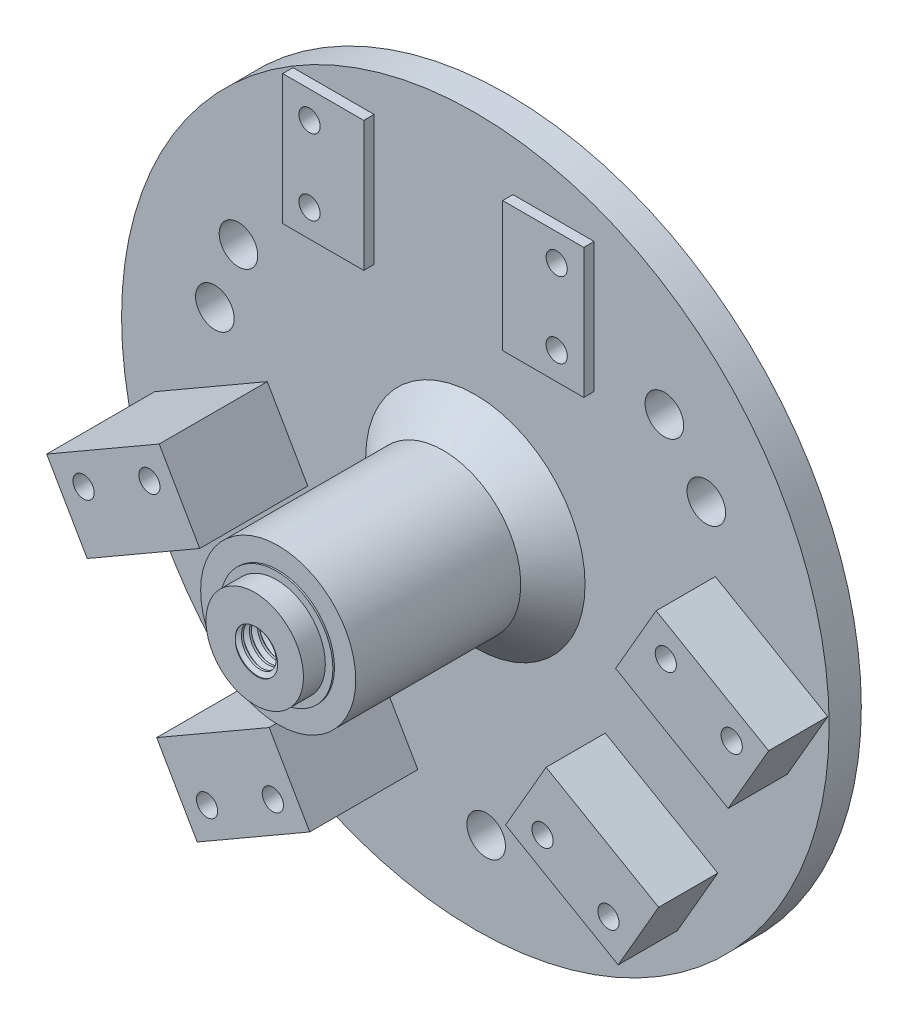
from build123d import *

# Parameters (mm, degrees)
SKETCH3_W               = 0.68
SKETCH3_H               = 3
SKETCH3_W_2             = 55
SKETCH3_H_2             = 5
CUT_EXTRUDE1_DEPTH      = 10
CUT_EXTRUDE1_DEPTH_BACK = 12
SKETCH2_R               = 3
BOSS_EXTRUDE1_DEPTH     = 16.8
SKETCH4_4_W             = 12.600000858
SKETCH4_4_H             = 20.200000763
SKETCH4_4_W_2           = 12.600000381
BOSS_EXTRUDE2_DEPTH     = 1.6
BOSS_EXTRUDE3_DEPTH     = 9.2
SKETCH5_R               = 3.1
CUT_EXTRUDE5_DEPTH      = 4
SKETCH5_4_R             = 3.1
CUT_EXTRUDE6_DEPTH      = 18
SKETCH5_5_R             = 3.1
CUT_EXTRUDE8_DEPTH      = 10.4
SKETCH7_R               = 1.65
CUT_EXTRUDE9_DEPTH      = 87.966717772
SCALE1_SCALE            = 2
SKETCH11_R              = 24.109521865
CUT_EXTRUDE11_DEPTH     = 174.602862566
SKETCH11_3_R            = 15.15
SKETCH11_3_R_2          = 7.930840121
BOSS_EXTRUDE4_DEPTH     = 6.8
SKETCH11_4_R            = 24.109521865
SKETCH11_4_R_2          = 17.5
CUT_EXTRUDE12_DEPTH     = 0.5
BOSS_EXTRUDE6_REACH     = 178.524
SKETCH18_R              = 7.930840121
SKETCH18_R_2            = 6
THREAD1_PITCH           = 2.5
BOSS_EXTRUDE5_REACH     = 166.561
SKETCH17_R              = 24.109521865


with BuildPart() as part:
    # Sketch3 → Revolve1 (revolve)
    with BuildSketch(Plane(origin=(0, 0, 0), x_dir=(1, 0, 0), z_dir=(0, 1, 0))):
        Polygon((-7.645420061, -35.9), (-4.645420061, -38.9), (-4.645420061, -35.9), align=None)
        with Locations((-4.305420061, -37.4)):
            Rectangle(SKETCH3_W, SKETCH3_H)
        Polygon((-12.054760933, -35.9), (-7.645420061, -35.9), (-4.645420061, -35.9), (-3.965420061, -35.9), (-3.965420061, -22.9), (-12.054760933, -22.9), align=None)
        Polygon((-12.054760933, -10), (-12.054760933, -22.9), (-3.965420061, -22.9), (0, -22.9), (0, -5), (-12.054760933, -5), align=None)
        Polygon((-17.054760933, -5), (-12.054760933, -10), (-12.054760933, -5), align=None)
        with Locations((-27.5, -2.5)):
            Rectangle(SKETCH3_W_2, SKETCH3_H_2)
    revolve(axis=Axis((0, 0, 5), (0, 0, 1)))

    # Sketch2 → Cut-Extrude1 (cut, two sides: drawn at the far end of the back side and taken through both)
    with BuildSketch(Plane.XY.offset(5).offset(-CUT_EXTRUDE1_DEPTH_BACK)):
        with Locations(Location((13.803478901, -39.013819102, 0), (0, 0, 180))):
            Circle(SKETCH2_R)
        with Locations(Location((35.899775547, 20.586894529, 0), (0, 0, 180))):
            Circle(SKETCH2_R)
        with Locations(Location((-40.493351311, 8.538302541, 0), (0, 0, 180))):
            Circle(SKETCH2_R)
        with Locations(Location((-36.826745231, 18.838441013, 0), (0, 0, 180))):
            Circle(SKETCH2_R)
        with Locations(Location((29.37902748, 29.059332082, 0), (0, 0, 180))):
            Circle(SKETCH2_R)
        with Locations(Location((1.676490042, -41.417283915, 0), (0, 0, 180))):
            Circle(SKETCH2_R)
    extrude(amount=CUT_EXTRUDE1_DEPTH + CUT_EXTRUDE1_DEPTH_BACK, mode=Mode.SUBTRACT)

    # Sketch4 → Boss-Extrude1 (add)
    with BuildSketch(Plane.XY.offset(5)):
        Polygon((-43.541591644, -18.383750916), (-49.841590881, -7.471831322), (-32.347877502, 2.628168583), (-26.047878265, -8.283751488), align=None)
        Polygon((-26.441591263, -48.001819611), (-32.741592407, -37.08990097), (-15.247878075, -26.989900589), (-8.947877884, -37.901821136), align=None)
    extrude(amount=BOSS_EXTRUDE1_DEPTH)

    # Sketch4<4> → Boss-Extrude2 (add)
    with BuildSketch(Plane.XY.offset(5)):
        with Locations((12.150000334, 36.800001145)):
            Rectangle(SKETCH4_4_W, SKETCH4_4_H)
        with Locations((-22.050000191, 36.800001145)):
            Rectangle(SKETCH4_4_W_2, SKETCH4_4_H)
    extrude(amount=BOSS_EXTRUDE2_DEPTH)

    # Sketch4<5> → Boss-Extrude3 (add)
    with BuildSketch(Plane.XY.offset(5)):
        Polygon((48.491592407, -9.810099602), (54.791591644, 1.10182023), (37.297878265, 11.201820374), (30.997879028, 0.289900124), align=None)
        Polygon((31.391592026, -39.42816925), (13.897878647, -29.328168869), (20.197877884, -18.416248322), (37.69159317, -28.516248703), align=None)
    extrude(amount=BOSS_EXTRUDE3_DEPTH)

    # Sketch5 → Cut-Extrude5 (cut)
    with BuildSketch(Plane(origin=(0, 0, 0), x_dir=(-1, 0, 0), z_dir=(0, 0, -1))):
        with BuildLine():
            ThreePointArc((-11.140577359, 30.950224204), (-12.048546338, 33.142255226), (-14.240577359, 34.050224204))
            Line((-14.240577359, 34.050224204), (-14.240577359, 30.950224204))
            Line((-14.240577359, 30.950224204), (-11.140577359, 30.950224204))
        make_face()
        with BuildLine():
            Line((-14.240577359, 30.950224204), (-14.240577359, 34.050224204))
            ThreePointArc((-14.240577359, 34.050224204), (-16.432608381, 28.758193182), (-11.140577359, 30.950224204))
            Line((-11.140577359, 30.950224204), (-14.240577359, 30.950224204))
        make_face()
        with BuildLine():
            ThreePointArc((27.283792738, 42.684548682), (24.183792738, 45.784548682), (21.083792738, 42.684548682))
            Line((21.083792738, 42.684548682), (24.183792738, 42.684548682))
            Line((24.183792738, 42.684548682), (24.183792738, 39.584548682))
            ThreePointArc((24.183792738, 39.584548682), (26.37582376, 40.49251766), (27.283792738, 42.684548682))
        make_face()
        with BuildLine():
            Line((24.183792738, 42.684548682), (21.083792738, 42.684548682))
            ThreePointArc((21.083792738, 42.684548682), (21.991761717, 40.49251766), (24.183792738, 39.584548682))
            Line((24.183792738, 39.584548682), (24.183792738, 42.684548682))
        make_face()
        with Locations((-14.240577359, 42.684548682)):
            Circle(SKETCH5_R)
        with Locations((24.183792738, 30.950224204)):
            Circle(SKETCH5_R)
    extrude(amount=-CUT_EXTRUDE5_DEPTH, mode=Mode.SUBTRACT)

    # Sketch5<4> → Cut-Extrude6 (cut)
    with BuildSketch(Plane(origin=(0, 0, 0), x_dir=(-1, 0, 0), z_dir=(0, 0, -1))):
        with Locations((33.875754671, -3.099811123)):
            Circle(SKETCH5_4_R)
        with Locations((44.099956238, -8.995818047)):
            Circle(SKETCH5_4_R)
        with Locations((24.908172665, -42.276081486)):
            Circle(SKETCH5_4_R)
        with Locations((14.683971099, -36.380074562)):
            Circle(SKETCH5_4_R)
    extrude(amount=-CUT_EXTRUDE6_DEPTH, mode=Mode.SUBTRACT)

    # Sketch5<5> → Cut-Extrude8 (cut)
    with BuildSketch(Plane(origin=(0, 0, 0), x_dir=(-1, 0, 0), z_dir=(0, 0, -1))):
        with Locations((-29.885597463, -33.693939972)):
            Circle(SKETCH5_5_R)
        with Locations((-19.645932494, -27.794047835)):
            Circle(SKETCH5_5_R)
        with Locations((-49.047480403, -0.437185967)):
            Circle(SKETCH5_5_R)
        with Locations((-38.807815434, 5.46270617)):
            Circle(SKETCH5_5_R)
    extrude(amount=-CUT_EXTRUDE8_DEPTH, mode=Mode.SUBTRACT)

    # Sketch7 → Cut-Extrude9 (cut, through all)
    with BuildSketch(Plane(origin=(0, 0, 0), x_dir=(-1, 0, 0), z_dir=(0, 0, -1))):
        with Locations((-38.807815434, 5.46270617)):
            Circle(SKETCH7_R)
        with Locations((-49.047480403, -0.437185967)):
            Circle(SKETCH7_R)
        with Locations((-14.240577359, 42.684548682)):
            Circle(SKETCH7_R)
        with Locations((-14.240577359, 30.950224204)):
            Circle(SKETCH7_R)
        with Locations((24.183792738, 30.950224204)):
            Circle(SKETCH7_R)
        with Locations((24.183792738, 42.684548682)):
            Circle(SKETCH7_R)
        with Locations((44.099956238, -8.995818047)):
            Circle(SKETCH7_R)
        with Locations((33.875754671, -3.099811123)):
            Circle(SKETCH7_R)
        with Locations((14.683971099, -36.380074562)):
            Circle(SKETCH7_R)
        with Locations((24.908172665, -42.276081486)):
            Circle(SKETCH7_R)
        with Locations((-19.645932494, -27.794047835)):
            Circle(SKETCH7_R)
        with Locations((-29.885597463, -33.693939972)):
            Circle(SKETCH7_R)
    extrude(amount=-CUT_EXTRUDE9_DEPTH, mode=Mode.SUBTRACT)


with BuildPart() as part_1:
    # Scale1: scaled about (-1.012493722, -2.511955492, 7.497325728)
    add(part.part.scale(SCALE1_SCALE).moved(Location((1.012493722, 2.511955492, -7.497325728))))

    # Sketch11 → Cut-Extrude11 (cut, through all)
    with BuildSketch(Plane.XY.offset(64.302674272)):
        with Locations(Location((1.012493722, 2.511955492, 0), (0, 0, 180))):
            Circle(SKETCH11_R)
    extrude(amount=CUT_EXTRUDE11_DEPTH, mode=Mode.SUBTRACT)

    # Sketch11<3> → Boss-Extrude4 (add)
    with BuildSketch(Plane.XY.offset(64.302674272)):
        with Locations((1.012493722, 2.511955492)):
            Circle(SKETCH11_3_R)
        with Locations(Location((1.012493722, 2.511955492, 0), (0, 0, 180))):
            Circle(SKETCH11_3_R_2, mode=Mode.SUBTRACT)
    extrude(amount=BOSS_EXTRUDE4_DEPTH)

    # Sketch11<4> → Cut-Extrude12 (cut)
    with BuildSketch(Plane.XY.offset(64.302674272)):
        with Locations(Location((1.012493722, 2.511955492, 0), (0, 0, 180))):
            Circle(SKETCH11_4_R)
        with Locations((1.012493722, 2.511955492)):
            Circle(SKETCH11_4_R_2, mode=Mode.SUBTRACT)
    extrude(amount=-CUT_EXTRUDE12_DEPTH, mode=Mode.SUBTRACT)

    # Sketch18 → Boss-Extrude6 (add, up to next)
    with BuildSketch(Plane.XY.offset(71.102674272), mode=Mode.PRIVATE) as boss_extrude6_sk1:
        with Locations((1.012493722, 2.511955492)):
            Circle(SKETCH18_R)
        with Locations((1.012493722, 2.511955492)):
            Circle(SKETCH18_R_2, mode=Mode.SUBTRACT)
    boss_extrude6_tool1 = extrude(boss_extrude6_sk1.sketch, amount=-BOSS_EXTRUDE6_REACH, mode=Mode.PRIVATE) - part_1.part
    add(boss_extrude6_tool1.solids().sort_by_distance((-6.694028, 2.511955, 71.102674))[0])

    # Thread1: arcs per turn and ends read off the stored shape
    # Thread1: the profile of Thread Profile1 profile screwed along a right-hand helix through 15.12 turns, 10 arcs to a turn; built about Z, then put on its axis
    thread1_z = Axis((0, 0, 0), (0, 0, 1))
    thread1_corners = [(5.9997, 0, -0.000173205), (7.353164688, 0, 0.781249997), (7.353164688, 0, 1.093749997), (5.9997, 0, 1.875173198)]
    with BuildLine(mode=Mode.PRIVATE) as thread1_profile:
        Line(thread1_corners[0], thread1_corners[1])
        Line(thread1_corners[1], thread1_corners[2])
        Line(thread1_corners[2], thread1_corners[3])
        Line(thread1_corners[3], thread1_corners[0])
    thread1_cap = Face(thread1_profile.wire())
    thread1_turn_angles = [0, 18, 36, 54, 72, 90, 108, 126, 144, 162, 180, 198, 216, 234, 252, 270, 288, 306, 324, 342, 360]
    thread1_turn_weights = [1, 0.9510565162951535, 1, 0.9510565162951535, 1, 0.9510565162951535, 1, 0.9510565162951535, 1, 0.9510565162951535, 1, 0.9510565162951535, 1, 0.9510565162951535, 1, 0.9510565162951535, 1, 0.9510565162951535, 1, 0.9510565162951535, 1]
    thread1_turn_rails = [Edge.make_bspline([Vector(p[0], p[1], 0).rotate(thread1_z, thread1_turn_angles[k]) / thread1_turn_weights[k] + Vector(0, 0, p[2] + THREAD1_PITCH * thread1_turn_angles[k] / 360) for k in range(21)], [0, 0, 0, 1, 1, 2, 2, 3, 3, 4, 4, 5, 5, 6, 6, 7, 7, 8, 8, 9, 9, 10, 10, 10], 2, thread1_turn_weights) for p in thread1_corners]
    thread1_turn_sides = [Face.make_surface_from_curves(thread1_turn_rails[p[0]], thread1_turn_rails[p[1]]) for p in [(0, 1), (1, 2), (2, 3), (3, 0)]]
    thread1_last_angles = [5400, 5418, 5436, 5439.6, 5443.2]
    thread1_last_weights = [1, 0.9510565162951535, 1, 0.9980267284282711, 1]
    thread1_last_rails = [Edge.make_bspline([Vector(p[0], p[1], 0).rotate(thread1_z, thread1_last_angles[k]) / thread1_last_weights[k] + Vector(0, 0, p[2] + THREAD1_PITCH * thread1_last_angles[k] / 360) for k in range(5)], [0, 0, 0, 1, 1, 2, 2, 2], 2, thread1_last_weights) for p in thread1_corners]
    thread1_last_sides = [Face.make_surface_from_curves(thread1_last_rails[p[0]], thread1_last_rails[p[1]]) for p in [(0, 1), (1, 2), (2, 3), (3, 0)]]
    thread1 = Plane(origin=(1.012493722, 2.511955492, 76.102674272), x_dir=(-1, 0, 0), z_dir=(0, 0, -1)) * Solid(Shell([*[p.moved(Location((0, 0, THREAD1_PITCH * i))) for i in range(15) for p in thread1_turn_sides], *thread1_last_sides, thread1_cap, thread1_cap.rotate(thread1_z, 5443.2).moved(Location((0, 0, THREAD1_PITCH * 5443.2 / 360)))]))
    add(thread1, mode=Mode.SUBTRACT)

    # Sketch17 → Boss-Extrude5 (add, up to next)
    with BuildSketch(Plane.XY.offset(38.302674272), mode=Mode.PRIVATE) as boss_extrude5_sk1:
        with Locations(Location((1.012493722, 2.511955492, 0), (0, 0, 180))):
            Circle(SKETCH17_R)
    boss_extrude5_tool1 = extrude(boss_extrude5_sk1.sketch, amount=-BOSS_EXTRUDE5_REACH, mode=Mode.PRIVATE) - part_1.part
    add(boss_extrude5_tool1.solids().sort_by_distance((1.012494, 2.511955, 38.302674))[0])


solid = part_1.part
